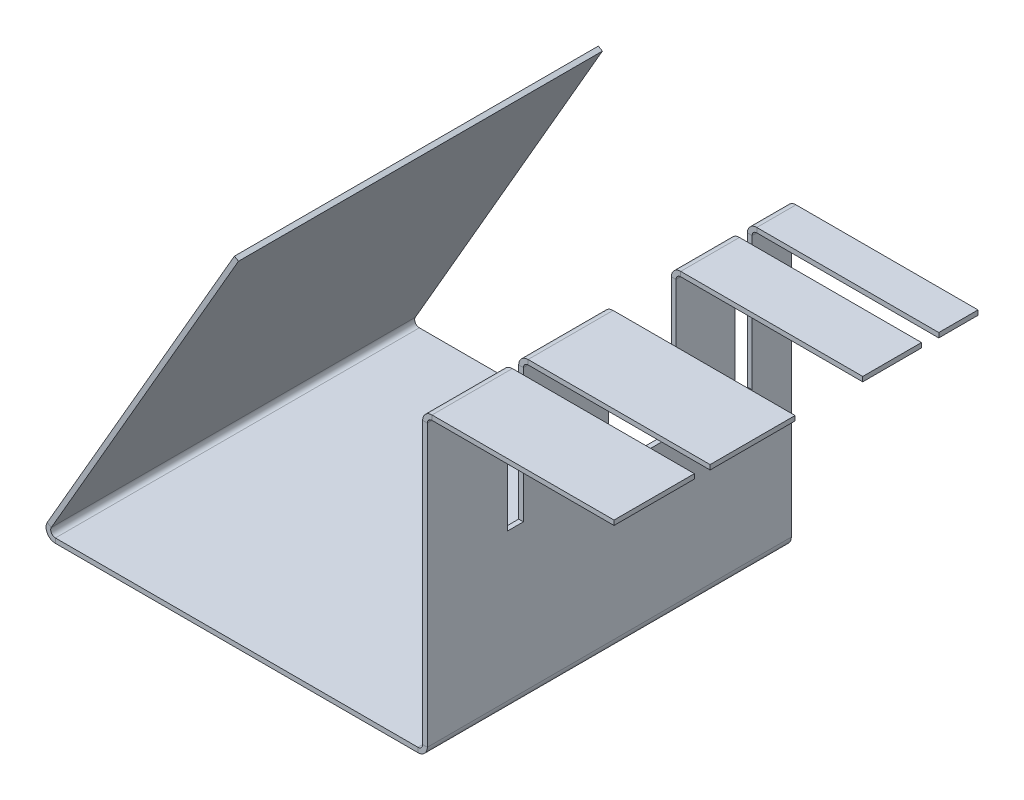
from build123d import *

# Parameters (mm, degrees)
SKETCH1_W                      = 58.831256187
SKETCH1_H                      = 57.04415391
BASE_FLANGE1_DEPTH             = 0.7366
EDGE_FLANGE1_STRIP_W           = 4.4196
EDGE_FLANGE1_STRIP_H           = 0.7366
EDGE_FLANGE1_STRIP_CUT_DEPTH   = 57.044153909
EDGE_FLANGE1_DEPTH             = 57.044153909
SKETCH7_W                      = 2.712818276
SKETCH7_H                      = 25.730670316
SKETCH7_W_2                    = 10.604653262
SKETCH7_H_2                    = 26.641488396
SKETCH7_W_3                    = 2.466198433
SKETCH7_H_3                    = 28.772283842
CUT_EXTRUDE1_DEPTH             = 10
EDGE_FLANGE2_STRIP_CUT_DEPTH   = 57.044153909
EDGE_FLANGE2_DEPTH             = 57.044153909
EDGE_FLANGE3_STRIP_W           = 4.4196
EDGE_FLANGE3_STRIP_H           = 0.7366
EDGE_FLANGE3_STRIP_CUT_DEPTH   = 6.14423041
EDGE_FLANGE3_STRIP_2_W         = 4.4196
EDGE_FLANGE3_STRIP_2_H         = 0.7366
EDGE_FLANGE3_STRIP_CUT_2_DEPTH = 9.207140816
EDGE_FLANGE3_STRIP_3_W         = 4.4196
EDGE_FLANGE3_STRIP_3_H         = 0.7366
EDGE_FLANGE3_STRIP_CUT_3_DEPTH = 13.317471538
EDGE_FLANGE3_STRIP_4_W         = 4.4196
EDGE_FLANGE3_STRIP_4_H         = 0.7366
EDGE_FLANGE3_STRIP_CUT_4_DEPTH = 12.591641176
EDGE_FLANGE3_DEPTH             = 6.14423041
EDGE_FLANGE3_BEND_DEPTH        = 9.207140816
EDGE_FLANGE3_BEND_2_DEPTH      = 13.317471538
EDGE_FLANGE3_BEND_3_DEPTH      = 12.591641176


# Sheet-metal steps are written as plain solids
with BuildPart() as part:
    # Sketch1 → Base-Flange1 (new body)
    with BuildSketch(Plane(origin=(0, 0, 0), x_dir=(1, 0, 0), z_dir=(0, 1, 0))):
        with Locations((-15.871888874, -5.505069705)):
            Rectangle(SKETCH1_W, SKETCH1_H)
    extrude(amount=-BASE_FLANGE1_DEPTH)

    # Edge-Flange1 strip (across the edge) → Edge-Flange1 strip cut (cut)
    with BuildSketch(Plane(origin=(13.54373922, 0, 34.02714666), x_dir=(-1, 0, 0), z_dir=(0, 0, -1))):
        with Locations((-1.4732, -0.3683)):
            Rectangle(EDGE_FLANGE1_STRIP_W, EDGE_FLANGE1_STRIP_H)
    extrude(amount=EDGE_FLANGE1_STRIP_CUT_DEPTH, mode=Mode.SUBTRACT)

    # Edge-Flange1 section (across the edge) → Edge-Flange1 (add)
    with BuildSketch(Plane(origin=(13.54373922, 0, 34.02714666), x_dir=(-1, 0, 0), z_dir=(0, 0, -1))):
        with BuildLine():
            Line((-0.7366, 0.7366), (-0.7366, 45.4732))
            Line((-0.7366, 45.4732), (0, 45.4732))
            Line((0, 45.4732), (0, 0.7366))
            ThreePointArc((0, 0.7366), (0.215745145, 0.215745145), (0.7366, 0))
            Line((0.7366, 0), (0.7366, -0.7366))
            ThreePointArc((0.7366, -0.7366), (-0.30510971, -0.30510971), (-0.7366, 0.7366))
        make_face()
    extrude(amount=EDGE_FLANGE1_DEPTH)

    # Sketch7 → Cut-Extrude1 (cut)
    with BuildSketch(Plane.ZY.offset(-13.54373922)):
        with Locations((-15.516367702, 36.672250911)):
            Rectangle(SKETCH7_W, SKETCH7_H)
        with Locations((0.349508883, 37.127659951)):
            Rectangle(SKETCH7_W_2, SKETCH7_H_2)
        with Locations((20.202406268, 38.193057674)):
            Rectangle(SKETCH7_W_3, SKETCH7_H_3)
    extrude(amount=-CUT_EXTRUDE1_DEPTH, mode=Mode.SUBTRACT)

    # Edge-Flange2 strip (across the edge) → Edge-Flange2 strip cut (cut)
    with BuildSketch(Plane(origin=(-45.287516967, 0, -23.01700725), x_dir=(0.8660254037844398, -0.499999999999998, 0), z_dir=(0, 0, 1))):
        Polygon((-5.1562, -3.827485875), (1.4732, 0), (1.1049, 0.637914312), (-5.5245, -3.189571562), align=None)
    extrude(amount=EDGE_FLANGE2_STRIP_CUT_DEPTH, mode=Mode.SUBTRACT)

    # Edge-Flange2 section (across the edge) → Edge-Flange2 (add)
    with BuildSketch(Plane(origin=(-45.287516967, 0, -23.01700725), x_dir=(0.8660254037844398, -0.499999999999998, 0), z_dir=(0, 0, 1))):
        with BuildLine():
            Line((-0.7366, 1.275828625), (-0.7366, 59.933971375))
            Line((-0.7366, 59.933971375), (0, 59.933971375))
            Line((0, 59.933971375), (0, 1.275828625))
            ThreePointArc((0, 1.275828625), (0.3683, 0.637914312), (1.1049, 0.637914312))
            Line((1.1049, 0.637914312), (1.4732, 0))
            ThreePointArc((1.4732, 0), (0, 0), (-0.7366, 1.275828625))
        make_face()
    extrude(amount=EDGE_FLANGE2_DEPTH)

    # Edge-Flange3 strip (across the edge) → Edge-Flange3 strip cut (cut)
    with BuildSketch(Plane(origin=(14.28033922, 45.4732, -23.01700725), x_dir=(0, -1, 0), z_dir=(0, 0, 1))):
        with Locations((-1.4732, -0.3683)):
            Rectangle(EDGE_FLANGE3_STRIP_W, EDGE_FLANGE3_STRIP_H)
    extrude(amount=EDGE_FLANGE3_STRIP_CUT_DEPTH, mode=Mode.SUBTRACT)

    # Edge-Flange3 strip 2 (across the edge) → Edge-Flange3 strip cut 2 (cut)
    with BuildSketch(Plane(origin=(14.28033922, 45.4732, -14.159958564), x_dir=(0, -1, 0), z_dir=(0, 0, 1))):
        with Locations((-1.4732, -0.3683)):
            Rectangle(EDGE_FLANGE3_STRIP_2_W, EDGE_FLANGE3_STRIP_2_H)
    extrude(amount=EDGE_FLANGE3_STRIP_CUT_2_DEPTH, mode=Mode.SUBTRACT)

    # Edge-Flange3 strip 3 (across the edge) → Edge-Flange3 strip cut 3 (cut)
    with BuildSketch(Plane(origin=(14.28033922, 45.4732, 5.651835514), x_dir=(0, -1, 0), z_dir=(0, 0, 1))):
        with Locations((-1.4732, -0.3683)):
            Rectangle(EDGE_FLANGE3_STRIP_3_W, EDGE_FLANGE3_STRIP_3_H)
    extrude(amount=EDGE_FLANGE3_STRIP_CUT_3_DEPTH, mode=Mode.SUBTRACT)

    # Edge-Flange3 strip 4 (across the edge) → Edge-Flange3 strip cut 4 (cut)
    with BuildSketch(Plane(origin=(14.28033922, 45.4732, 21.435505484), x_dir=(0, -1, 0), z_dir=(0, 0, 1))):
        with Locations((-1.4732, -0.3683)):
            Rectangle(EDGE_FLANGE3_STRIP_4_W, EDGE_FLANGE3_STRIP_4_H)
    extrude(amount=EDGE_FLANGE3_STRIP_CUT_4_DEPTH, mode=Mode.SUBTRACT)

    # Edge-Flange3 section (across the edge) → Edge-Flange3 (add)
    with BuildSketch(Plane(origin=(14.28033922, 45.4732, -23.01700725), x_dir=(0, -1, 0), z_dir=(0, 0, 1))):
        with BuildLine():
            Line((-0.7366, 0.7366), (-0.7366, 29.2634))
            Line((-0.7366, 29.2634), (0, 29.2634))
            Line((0, 29.2634), (0, 0.7366))
            ThreePointArc((0, 0.7366), (0.215745145, 0.215745145), (0.7366, 0))
            Line((0.7366, 0), (0.7366, -0.7366))
            ThreePointArc((0.7366, -0.7366), (-0.30510971, -0.30510971), (-0.7366, 0.7366))
        make_face()
    extrude(amount=EDGE_FLANGE3_DEPTH)

    # Edge-Flange3 section 2 (across the edge) → Edge-Flange3 bend (add)
    with BuildSketch(Plane(origin=(14.28033922, 45.4732, -14.159958564), x_dir=(0, -1, 0), z_dir=(0, 0, 1))):
        with BuildLine():
            Line((-0.7366, 0.7366), (-0.7366, 29.2634))
            Line((-0.7366, 29.2634), (0, 29.2634))
            Line((0, 29.2634), (0, 0.7366))
            ThreePointArc((0, 0.7366), (0.215745145, 0.215745145), (0.7366, 0))
            Line((0.7366, 0), (0.7366, -0.7366))
            ThreePointArc((0.7366, -0.7366), (-0.30510971, -0.30510971), (-0.7366, 0.7366))
        make_face()
    extrude(amount=EDGE_FLANGE3_BEND_DEPTH)

    # Edge-Flange3 section 3 (across the edge) → Edge-Flange3 bend 2 (add)
    with BuildSketch(Plane(origin=(14.28033922, 45.4732, 5.651835514), x_dir=(0, -1, 0), z_dir=(0, 0, 1))):
        with BuildLine():
            Line((-0.7366, 0.7366), (-0.7366, 29.2634))
            Line((-0.7366, 29.2634), (0, 29.2634))
            Line((0, 29.2634), (0, 0.7366))
            ThreePointArc((0, 0.7366), (0.215745145, 0.215745145), (0.7366, 0))
            Line((0.7366, 0), (0.7366, -0.7366))
            ThreePointArc((0.7366, -0.7366), (-0.30510971, -0.30510971), (-0.7366, 0.7366))
        make_face()
    extrude(amount=EDGE_FLANGE3_BEND_2_DEPTH)

    # Edge-Flange3 section 4 (across the edge) → Edge-Flange3 bend 3 (add)
    with BuildSketch(Plane(origin=(14.28033922, 45.4732, 21.435505484), x_dir=(0, -1, 0), z_dir=(0, 0, 1))):
        with BuildLine():
            Line((-0.7366, 0.7366), (-0.7366, 29.2634))
            Line((-0.7366, 29.2634), (0, 29.2634))
            Line((0, 29.2634), (0, 0.7366))
            ThreePointArc((0, 0.7366), (0.215745145, 0.215745145), (0.7366, 0))
            Line((0.7366, 0), (0.7366, -0.7366))
            ThreePointArc((0.7366, -0.7366), (-0.30510971, -0.30510971), (-0.7366, 0.7366))
        make_face()
    extrude(amount=EDGE_FLANGE3_BEND_3_DEPTH)


solid = part.part
